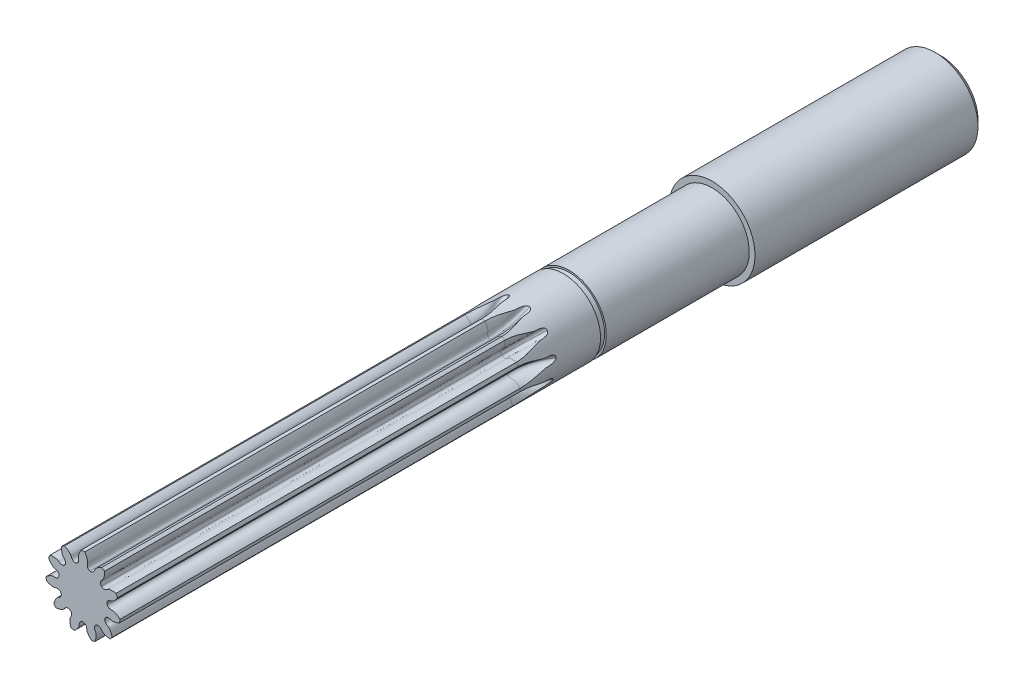
from build123d import *

# Parameters (mm, degrees)
EXTRUDE_1_DEPTH          = 70
PATTERN_CIRCULAR_1_COUNT = 11


with BuildPart() as part:
    # Эскиз1 → Бобышка-Вытянуть1 (new body)
    with BuildSketch(Plane.XY):
        with BuildLine():
            ThreePointArc((0.303, 6.493), (0, 6.500066), (-0.303, 6.493))
            add(Edge.make_bspline(
                [(-0.303, 6.493), (-0.346584218, 6.42959541), (-0.414908989, 6.322872217), (-0.503832534, 6.171085791), (-0.571642486, 6.040604913), (-0.631254096, 5.909462755), (-0.68518257, 5.779105167), (-0.72964324, 5.648408312), (-0.767399302, 5.518328721), (-0.797951002, 5.37284466), (-0.827792109, 5.196066136), (-0.768218484, 4.972302757), (-0.736721493, 4.755594452), (-0.753966504, 4.568401559), (-0.785235089, 4.447093131), (-0.829023332, 4.351746005), (-0.87759341, 4.275547448), (-0.932758863, 4.214584459), (-1.017734715, 4.14379099), (-1.09368593, 4.106410336), (-1.15, 4.092)],
                knots=[0, 0, 0, 0, 0.085617132, 0.140969585, 0.1957209, 0.24916994, 0.301247193, 0.352628837, 0.402767547, 0.451734397, 0.518547692, 0.59904648, 0.705842174, 0.760987907, 0.80705749, 0.844573024, 0.877292442, 0.9072362, 0.935685939, 1, 1, 1, 1], degree=3))
            ThreePointArc((-1.15, 4.092), (-1.197511317, 4.07834901), (-1.244860662, 4.064146396))
            add(Edge.make_bspline(
                [(-3.255481007, 5.626073356), (-3.184536521, 5.596297428), (-3.069359152, 5.543455325), (-2.912489968, 5.463840156), (-2.784901317, 5.390733484), (-2.663852036, 5.31263815), (-2.548007884, 5.232130303), (-2.439945133, 5.146218365), (-2.337856377, 5.057200918), (-2.23350003, 4.951329433), (-2.112822407, 4.818747197), (-2.041963313, 4.59829753), (-1.951298913, 4.398962343), (-1.835587368, 4.250809018), (-1.743698272, 4.165662948), (-1.655312711, 4.109125552), (-1.573256911, 4.071282214), (-1.493889699, 4.04982158), (-1.384129623, 4.036207738), (-1.300025889, 4.045823457), (-1.244860662, 4.064146396)],
                knots=[0, 0, 0, 0, 0.085617132, 0.140969585, 0.1957209, 0.24916994, 0.301247193, 0.352628837, 0.402767547, 0.451734397, 0.518547692, 0.59904648, 0.705842174, 0.760987907, 0.80705749, 0.844573024, 0.877292442, 0.9072362, 0.935685939, 1, 1, 1, 1], degree=3))
            ThreePointArc((-3.255481007, 5.626073356), (-3.514200996, 5.468203486), (-3.765280648, 5.298445021))
            add(Edge.make_bspline(
                [(-3.765280648, 5.298445021), (-3.767666916, 5.221542278), (-3.767446457, 5.094821856), (-3.760191766, 4.91905529), (-3.746693839, 4.772626962), (-3.725941513, 4.630074689), (-3.700832399, 4.491254973), (-3.66757504, 4.357268529), (-3.629011125, 4.227426146), (-3.576058228, 4.08851967), (-3.50558848, 3.923670791), (-3.334496341, 3.767636991), (-3.190838031, 3.602358923), (-3.104141339, 3.435558884), (-3.064861858, 3.316602666), (-3.050150324, 3.212717849), (-3.049814024, 3.122356577), (-3.063263076, 3.041246552), (-3.096475473, 2.935749881), (-3.140160193, 2.863240947), (-3.179743788, 2.820672516)],
                knots=[0, 0, 0, 0, 0.085617132, 0.140969585, 0.1957209, 0.24916994, 0.301247193, 0.352628837, 0.402767547, 0.451734397, 0.518547692, 0.59904648, 0.705842174, 0.760987907, 0.80705749, 0.844573024, 0.877292442, 0.9072362, 0.935685939, 1, 1, 1, 1], degree=3))
            ThreePointArc((-3.179743788, 2.820672516), (-3.212332568, 2.783502015), (-3.24448686, 2.745955028))
            add(Edge.make_bspline(
                [(-5.780369797, 2.972908174), (-5.704589415, 2.986214554), (-5.579127449, 3.004030536), (-5.404117483, 3.021863877), (-5.257258629, 3.029342263), (-5.113203968, 3.029088471), (-4.972223838, 3.023991037), (-4.834868167, 3.010140449), (-4.700859174, 2.990447556), (-4.555830583, 2.957802096), (-4.382630738, 2.91151007), (-4.203836187, 2.764365327), (-4.019795702, 2.645690773), (-3.842355221, 2.583614649), (-3.719019753, 2.561664212), (-3.614098664, 2.561886771), (-3.524609278, 2.574413643), (-3.446238836, 2.599268963), (-3.346542586, 2.647157048), (-3.280988673, 2.700716217), (-3.24448686, 2.745955028)],
                knots=[0, 0, 0, 0, 0.085617132, 0.140969585, 0.1957209, 0.24916994, 0.301247193, 0.352628837, 0.402767547, 0.451734397, 0.518547692, 0.59904648, 0.705842174, 0.760987907, 0.80705749, 0.844573024, 0.877292442, 0.9072362, 0.935685939, 1, 1, 1, 1], degree=3))
            ThreePointArc((-5.780369797, 2.972908174), (-5.912668005, 2.700225002), (-6.032111295, 2.421671185))
            add(Edge.make_bspline(
                [(-6.032111295, 2.421671185), (-5.992541989, 2.355686367), (-5.923846295, 2.249201553), (-5.82271668, 2.105259491), (-5.732196371, 1.989373673), (-5.637668826, 1.880670624), (-5.541494091, 1.777463059), (-5.441077679, 1.682726776), (-5.338437556, 1.594345639), (-5.218792234, 1.506118572), (-5.070385277, 1.405537693), (-4.84209517, 1.366773102), (-4.631886039, 1.305399889), (-4.468773231, 1.211950537), (-4.371416643, 1.13311429), (-4.30287614, 1.053674476), (-4.253740234, 0.977839554), (-4.221202906, 0.902334353), (-4.192107146, 0.795628928), (-4.189655782, 0.711012789), (-4.19994139, 0.653801439)],
                knots=[0, 0, 0, 0, 0.085617132, 0.140969585, 0.1957209, 0.24916994, 0.301247193, 0.352628837, 0.402767547, 0.451734397, 0.518547692, 0.59904648, 0.705842174, 0.760987907, 0.80705749, 0.844573024, 0.877292442, 0.9072362, 0.935685939, 1, 1, 1, 1], degree=3))
            ThreePointArc((-4.19994139, 0.653801439), (-4.207260927, 0.604912798), (-4.214011404, 0.55594234))
            add(Edge.make_bspline(
                [(-6.470032018, -0.624134348), (-6.413475476, -0.571970341), (-6.317562201, -0.489152723), (-6.179975881, -0.379532831), (-6.060473472, -0.293843722), (-5.939149769, -0.216175396), (-5.817793856, -0.144244018), (-5.694754719, -0.081635791), (-5.571372399, -0.025751776), (-5.431717116, 0.025193492), (-5.260984775, 0.079889067), (-5.031020774, 0.052766665), (-4.812035757, 0.052431075), (-4.62920244, 0.096140883), (-4.513578739, 0.144355189), (-4.425433827, 0.201267041), (-4.356923104, 0.260186931), (-4.304431493, 0.323466817), (-4.246451924, 0.417652699), (-4.220260736, 0.498150661), (-4.214011404, 0.55594234)],
                knots=[0, 0, 0, 0, 0.085617132, 0.140969585, 0.1957209, 0.24916994, 0.301247193, 0.352628837, 0.402767547, 0.451734397, 0.518547692, 0.59904648, 0.705842174, 0.760987907, 0.80705749, 0.844573024, 0.877292442, 0.9072362, 0.935685939, 1, 1, 1, 1], degree=3))
            ThreePointArc((-6.470032018, -0.624134348), (-6.4339047, -0.925055842), (-6.383789226, -1.223966142))
            add(Edge.make_bspline(
                [(-6.383789226, -1.223966142), (-6.314827322, -1.258083321), (-6.199466789, -1.310524351), (-6.03657019, -1.376941321), (-5.897767057, -1.425491701), (-5.75947612, -1.465833076), (-5.622770562, -1.500660817), (-5.4870766, -1.526068839), (-5.352947784, -1.544928343), (-5.204596581, -1.55446453), (-5.025370575, -1.558843691), (-4.812362995, -1.468031591), (-4.602342957, -1.406014386), (-4.414601197, -1.396443541), (-4.29007753, -1.410129868), (-4.189469184, -1.439903098), (-4.107133975, -1.477134618), (-4.03894064, -1.523062628), (-3.956774421, -1.597098588), (-3.908965263, -1.666956907), (-3.886687276, -1.720646976)],
                knots=[0, 0, 0, 0, 0.085617132, 0.140969585, 0.1957209, 0.24916994, 0.301247193, 0.352628837, 0.402767547, 0.451734397, 0.518547692, 0.59904648, 0.705842174, 0.760987907, 0.80705749, 0.844573024, 0.877292442, 0.9072362, 0.935685939, 1, 1, 1, 1], degree=3))
            ThreePointArc((-3.886687276, -1.720646976), (-3.866413668, -1.765731958), (-3.845617102, -1.810578113))
            add(Edge.make_bspline(
                [(-5.105504789, -4.023018624), (-5.08612839, -3.948558694), (-5.050215592, -3.827033449), (-4.993735603, -3.660430547), (-4.939530809, -3.523736401), (-4.879457483, -3.392805102), (-4.816255431, -3.266682615), (-4.746596885, -3.147493244), (-4.673014252, -3.0337751), (-4.583071843, -2.915413868), (-4.469013319, -2.777096149), (-4.260891813, -2.67558504), (-4.07648846, -2.557475118), (-3.946310592, -2.421856933), (-3.875108367, -2.318785587), (-3.831725018, -2.223253553), (-3.805944628, -2.136647294), (-3.795997565, -2.055033759), (-3.798142779, -1.944453431), (-3.819629834, -1.862574211), (-3.845617102, -1.810578113)],
                knots=[0, 0, 0, 0, 0.085617132, 0.140969585, 0.1957209, 0.24916994, 0.301247193, 0.352628837, 0.402767547, 0.451734397, 0.518547692, 0.59904648, 0.705842174, 0.760987907, 0.80705749, 0.844573024, 0.877292442, 0.9072362, 0.935685939, 1, 1, 1, 1], degree=3))
            ThreePointArc((-5.105504789, -4.023018624), (-4.912422113, -4.256637991), (-4.708659184, -4.481002867))
            add(Edge.make_bspline(
                [(-4.708659184, -4.481002867), (-4.632199599, -4.472420444), (-4.506800382, -4.454168033), (-4.333855317, -4.421972993), (-4.190838374, -4.387773532), (-4.052690441, -4.346945132), (-3.918857109, -4.302335487), (-3.790967469, -4.250348381), (-3.667934912, -4.193698492), (-3.537978286, -4.121516127), (-3.384836222, -4.028303218), (-3.254739572, -3.836746626), (-3.111588505, -3.671029028), (-2.958824475, -3.561476663), (-2.846669114, -3.505667756), (-2.745935363, -3.476321613), (-2.656541699, -3.463128986), (-2.574343258, -3.464897986), (-2.465193774, -3.482758587), (-2.387205893, -3.515679562), (-2.339437414, -3.548802134)],
                knots=[0, 0, 0, 0, 0.085617132, 0.140969585, 0.1957209, 0.24916994, 0.301247193, 0.352628837, 0.402767547, 0.451734397, 0.518547692, 0.59904648, 0.705842174, 0.760987907, 0.80705749, 0.844573024, 0.877292442, 0.9072362, 0.935685939, 1, 1, 1, 1], degree=3))
            ThreePointArc((-2.339437414, -3.548802134), (-2.298007388, -3.575769294), (-2.256266542, -3.602252808))
            add(Edge.make_bspline(
                [(-2.120015863, -6.144622913), (-2.143971476, -6.071507561), (-2.179461216, -5.949858095), (-2.222019554, -5.779167428), (-2.250322015, -5.634867671), (-2.270571922, -5.492243161), (-2.285589937, -5.351972564), (-2.291428078, -5.214043831), (-2.291007098, -5.078596266), (-2.279333643, -4.930397924), (-2.258161711, -4.752372961), (-2.137959807, -4.554457401), (-2.04668488, -4.355401032), (-2.010493015, -4.170932286), (-2.006318469, -4.045728322), (-2.02147059, -3.941906852), (-2.046605625, -3.855111099), (-2.082361231, -3.781075636), (-2.143950139, -3.689209335), (-2.206293448, -3.631944931), (-2.256266542, -3.602252808)],
                knots=[0, 0, 0, 0, 0.085617132, 0.140969585, 0.1957209, 0.24916994, 0.301247193, 0.352628837, 0.402767547, 0.451734397, 0.518547692, 0.59904648, 0.705842174, 0.760987907, 0.80705749, 0.844573024, 0.877292442, 0.9072362, 0.935685939, 1, 1, 1, 1], degree=3))
            ThreePointArc((-2.120015863, -6.144622913), (-1.831280214, -6.236767655), (-1.538563121, -6.315352842))
            add(Edge.make_bspline(
                [(-1.538563121, -6.315352842), (-1.478881232, -6.266795677), (-1.383256697, -6.183644836), (-1.255172002, -6.063059484), (-1.153348118, -5.956968269), (-1.059204181, -5.847932822), (-0.970734213, -5.738049039), (-0.891252954, -5.625172343), (-0.818378622, -5.510999001), (-0.748076884, -5.380015475), (-0.669640285, -5.218804936), (-0.663759331, -4.987321716), (-0.632926688, -4.770517892), (-0.563641889, -4.595766108), (-0.499463367, -4.488180901), (-0.430586467, -4.409032577), (-0.362516204, -4.34960437), (-0.292410081, -4.306652715), (-0.190931522, -4.262667342), (-0.107525519, -4.248198797), (-0.049432703, -4.250237688)],
                knots=[0, 0, 0, 0, 0.085617132, 0.140969585, 0.1957209, 0.24916994, 0.301247193, 0.352628837, 0.402767547, 0.451734397, 0.518547692, 0.59904648, 0.705842174, 0.760987907, 0.80705749, 0.844573024, 0.877292442, 0.9072362, 0.935685939, 1, 1, 1, 1], degree=3))
            ThreePointArc((-0.049432703, -4.250237688), (0, -4.250525144), (0.049432703, -4.250237688))
            add(Edge.make_bspline(
                [(1.538563121, -6.315352842), (1.478881232, -6.266795677), (1.383256697, -6.183644836), (1.255172002, -6.063059484), (1.153348118, -5.956968269), (1.059204181, -5.847932822), (0.970734213, -5.738049039), (0.891252954, -5.625172343), (0.818378622, -5.510999001), (0.748076884, -5.380015475), (0.669640285, -5.218804936), (0.663759331, -4.987321716), (0.632926688, -4.770517892), (0.563641889, -4.595766108), (0.499463367, -4.488180901), (0.430586467, -4.409032577), (0.362516204, -4.34960437), (0.292410081, -4.306652715), (0.190931522, -4.262667342), (0.107525519, -4.248198797), (0.049432703, -4.250237688)],
                knots=[0, 0, 0, 0, 0.085617132, 0.140969585, 0.1957209, 0.24916994, 0.301247193, 0.352628837, 0.402767547, 0.451734397, 0.518547692, 0.59904648, 0.705842174, 0.760987907, 0.80705749, 0.844573024, 0.877292442, 0.9072362, 0.935685939, 1, 1, 1, 1], degree=3))
            ThreePointArc((1.538563121, -6.315352842), (1.831280214, -6.236767655), (2.120015863, -6.144622913))
            add(Edge.make_bspline(
                [(2.120015863, -6.144622913), (2.143971476, -6.071507561), (2.179461216, -5.949858095), (2.222019554, -5.779167428), (2.250322015, -5.634867671), (2.270571922, -5.492243161), (2.285589937, -5.351972564), (2.291428078, -5.214043831), (2.291007098, -5.078596266), (2.279333643, -4.930397924), (2.258161711, -4.752372961), (2.137959807, -4.554457401), (2.04668488, -4.355401032), (2.010493015, -4.170932286), (2.006318469, -4.045728322), (2.02147059, -3.941906852), (2.046605625, -3.855111099), (2.082361231, -3.781075636), (2.143950139, -3.689209335), (2.206293448, -3.631944931), (2.256266542, -3.602252808)],
                knots=[0, 0, 0, 0, 0.085617132, 0.140969585, 0.1957209, 0.24916994, 0.301247193, 0.352628837, 0.402767547, 0.451734397, 0.518547692, 0.59904648, 0.705842174, 0.760987907, 0.80705749, 0.844573024, 0.877292442, 0.9072362, 0.935685939, 1, 1, 1, 1], degree=3))
            ThreePointArc((2.256266542, -3.602252808), (2.298007388, -3.575769294), (2.339437414, -3.548802134))
            add(Edge.make_bspline(
                [(4.708659184, -4.481002867), (4.632199599, -4.472420444), (4.506800382, -4.454168033), (4.333855317, -4.421972993), (4.190838374, -4.387773532), (4.052690441, -4.346945132), (3.918857109, -4.302335487), (3.790967469, -4.250348381), (3.667934912, -4.193698492), (3.537978286, -4.121516127), (3.384836222, -4.028303218), (3.254739572, -3.836746626), (3.111588505, -3.671029028), (2.958824475, -3.561476663), (2.846669114, -3.505667756), (2.745935363, -3.476321613), (2.656541699, -3.463128986), (2.574343258, -3.464897986), (2.465193774, -3.482758587), (2.387205893, -3.515679562), (2.339437414, -3.548802134)],
                knots=[0, 0, 0, 0, 0.085617132, 0.140969585, 0.1957209, 0.24916994, 0.301247193, 0.352628837, 0.402767547, 0.451734397, 0.518547692, 0.59904648, 0.705842174, 0.760987907, 0.80705749, 0.844573024, 0.877292442, 0.9072362, 0.935685939, 1, 1, 1, 1], degree=3))
            ThreePointArc((4.708659184, -4.481002867), (4.912422113, -4.256637991), (5.105504789, -4.023018624))
            add(Edge.make_bspline(
                [(5.105504789, -4.023018624), (5.08612839, -3.948558694), (5.050215592, -3.827033449), (4.993735603, -3.660430547), (4.939530809, -3.523736401), (4.879457483, -3.392805102), (4.816255431, -3.266682615), (4.746596885, -3.147493244), (4.673014252, -3.0337751), (4.583071843, -2.915413868), (4.469013319, -2.777096149), (4.260891813, -2.67558504), (4.07648846, -2.557475118), (3.946310592, -2.421856933), (3.875108367, -2.318785587), (3.831725018, -2.223253553), (3.805944628, -2.136647294), (3.795997565, -2.055033759), (3.798142779, -1.944453431), (3.819629834, -1.862574211), (3.845617102, -1.810578113)],
                knots=[0, 0, 0, 0, 0.085617132, 0.140969585, 0.1957209, 0.24916994, 0.301247193, 0.352628837, 0.402767547, 0.451734397, 0.518547692, 0.59904648, 0.705842174, 0.760987907, 0.80705749, 0.844573024, 0.877292442, 0.9072362, 0.935685939, 1, 1, 1, 1], degree=3))
            ThreePointArc((3.845617102, -1.810578113), (3.866413668, -1.765731958), (3.886687276, -1.720646976))
            add(Edge.make_bspline(
                [(6.383789226, -1.223966142), (6.314827322, -1.258083321), (6.199466789, -1.310524351), (6.03657019, -1.376941321), (5.897767057, -1.425491701), (5.75947612, -1.465833076), (5.622770562, -1.500660817), (5.4870766, -1.526068839), (5.352947784, -1.544928343), (5.204596581, -1.55446453), (5.025370575, -1.558843691), (4.812362995, -1.468031591), (4.602342957, -1.406014386), (4.414601197, -1.396443541), (4.29007753, -1.410129868), (4.189469184, -1.439903098), (4.107133975, -1.477134618), (4.03894064, -1.523062628), (3.956774421, -1.597098588), (3.908965263, -1.666956907), (3.886687276, -1.720646976)],
                knots=[0, 0, 0, 0, 0.085617132, 0.140969585, 0.1957209, 0.24916994, 0.301247193, 0.352628837, 0.402767547, 0.451734397, 0.518547692, 0.59904648, 0.705842174, 0.760987907, 0.80705749, 0.844573024, 0.877292442, 0.9072362, 0.935685939, 1, 1, 1, 1], degree=3))
            ThreePointArc((6.383789226, -1.223966142), (6.4339047, -0.925055842), (6.470032018, -0.624134348))
            add(Edge.make_bspline(
                [(6.470032018, -0.624134348), (6.413475476, -0.571970341), (6.317562201, -0.489152723), (6.179975881, -0.379532831), (6.060473472, -0.293843722), (5.939149769, -0.216175396), (5.817793856, -0.144244018), (5.694754719, -0.081635791), (5.571372399, -0.025751776), (5.431717116, 0.025193492), (5.260984775, 0.079889067), (5.031020774, 0.052766665), (4.812035757, 0.052431075), (4.62920244, 0.096140883), (4.513578739, 0.144355189), (4.425433827, 0.201267041), (4.356923104, 0.260186931), (4.304431493, 0.323466817), (4.246451924, 0.417652699), (4.220260736, 0.498150661), (4.214011404, 0.55594234)],
                knots=[0, 0, 0, 0, 0.085617132, 0.140969585, 0.1957209, 0.24916994, 0.301247193, 0.352628837, 0.402767547, 0.451734397, 0.518547692, 0.59904648, 0.705842174, 0.760987907, 0.80705749, 0.844573024, 0.877292442, 0.9072362, 0.935685939, 1, 1, 1, 1], degree=3))
            ThreePointArc((4.214011404, 0.55594234), (4.207260927, 0.604912798), (4.19994139, 0.653801439))
            add(Edge.make_bspline(
                [(6.032111295, 2.421671185), (5.992541989, 2.355686367), (5.923846295, 2.249201553), (5.82271668, 2.105259491), (5.732196371, 1.989373673), (5.637668826, 1.880670624), (5.541494091, 1.777463059), (5.441077679, 1.682726776), (5.338437556, 1.594345639), (5.218792234, 1.506118572), (5.070385277, 1.405537693), (4.84209517, 1.366773102), (4.631886039, 1.305399889), (4.468773231, 1.211950537), (4.371416643, 1.13311429), (4.30287614, 1.053674476), (4.253740234, 0.977839554), (4.221202906, 0.902334353), (4.192107146, 0.795628928), (4.189655782, 0.711012789), (4.19994139, 0.653801439)],
                knots=[0, 0, 0, 0, 0.085617132, 0.140969585, 0.1957209, 0.24916994, 0.301247193, 0.352628837, 0.402767547, 0.451734397, 0.518547692, 0.59904648, 0.705842174, 0.760987907, 0.80705749, 0.844573024, 0.877292442, 0.9072362, 0.935685939, 1, 1, 1, 1], degree=3))
            ThreePointArc((6.032111295, 2.421671185), (5.912668005, 2.700225002), (5.780369797, 2.972908174))
            add(Edge.make_bspline(
                [(5.780369797, 2.972908174), (5.704589415, 2.986214554), (5.579127449, 3.004030536), (5.404117483, 3.021863877), (5.257258629, 3.029342263), (5.113203968, 3.029088471), (4.972223838, 3.023991037), (4.834868167, 3.010140449), (4.700859174, 2.990447556), (4.555830583, 2.957802096), (4.382630738, 2.91151007), (4.203836187, 2.764365327), (4.019795702, 2.645690773), (3.842355221, 2.583614649), (3.719019753, 2.561664212), (3.614098664, 2.561886771), (3.524609278, 2.574413643), (3.446238836, 2.599268963), (3.346542586, 2.647157048), (3.280988673, 2.700716217), (3.24448686, 2.745955028)],
                knots=[0, 0, 0, 0, 0.085617132, 0.140969585, 0.1957209, 0.24916994, 0.301247193, 0.352628837, 0.402767547, 0.451734397, 0.518547692, 0.59904648, 0.705842174, 0.760987907, 0.80705749, 0.844573024, 0.877292442, 0.9072362, 0.935685939, 1, 1, 1, 1], degree=3))
            ThreePointArc((3.24448686, 2.745955028), (3.212332568, 2.783502015), (3.179743788, 2.820672516))
            add(Edge.make_bspline(
                [(3.765280648, 5.298445021), (3.767666916, 5.221542278), (3.767446457, 5.094821856), (3.760191766, 4.91905529), (3.746693839, 4.772626962), (3.725941513, 4.630074689), (3.700832399, 4.491254973), (3.66757504, 4.357268529), (3.629011125, 4.227426146), (3.576058228, 4.08851967), (3.50558848, 3.923670791), (3.334496341, 3.767636991), (3.190838031, 3.602358923), (3.104141339, 3.435558884), (3.064861858, 3.316602666), (3.050150324, 3.212717849), (3.049814024, 3.122356577), (3.063263076, 3.041246552), (3.096475473, 2.935749881), (3.140160193, 2.863240947), (3.179743788, 2.820672516)],
                knots=[0, 0, 0, 0, 0.085617132, 0.140969585, 0.1957209, 0.24916994, 0.301247193, 0.352628837, 0.402767547, 0.451734397, 0.518547692, 0.59904648, 0.705842174, 0.760987907, 0.80705749, 0.844573024, 0.877292442, 0.9072362, 0.935685939, 1, 1, 1, 1], degree=3))
            ThreePointArc((3.765280648, 5.298445021), (3.514200996, 5.468203486), (3.255481007, 5.626073356))
            add(Edge.make_bspline(
                [(3.255481007, 5.626073356), (3.184536521, 5.596297428), (3.069359152, 5.543455325), (2.912489968, 5.463840156), (2.784901317, 5.390733484), (2.663852036, 5.31263815), (2.548007884, 5.232130303), (2.439945133, 5.146218365), (2.337856377, 5.057200918), (2.23350003, 4.951329433), (2.112822407, 4.818747197), (2.041963313, 4.59829753), (1.951298913, 4.398962343), (1.835587368, 4.250809018), (1.743698272, 4.165662948), (1.655312711, 4.109125552), (1.573256911, 4.071282214), (1.493889699, 4.04982158), (1.384129623, 4.036207738), (1.300025889, 4.045823457), (1.244860662, 4.064146396)],
                knots=[0, 0, 0, 0, 0.085617132, 0.140969585, 0.1957209, 0.24916994, 0.301247193, 0.352628837, 0.402767547, 0.451734397, 0.518547692, 0.59904648, 0.705842174, 0.760987907, 0.80705749, 0.844573024, 0.877292442, 0.9072362, 0.935685939, 1, 1, 1, 1], degree=3))
            ThreePointArc((1.244860662, 4.064146396), (1.197511317, 4.07834901), (1.15, 4.092))
            add(Edge.make_bspline(
                [(0.303, 6.493), (0.346584218, 6.42959541), (0.414908989, 6.322872217), (0.503832534, 6.171085791), (0.571642486, 6.040604913), (0.631254096, 5.909462755), (0.68518257, 5.779105167), (0.72964324, 5.648408312), (0.767399302, 5.518328721), (0.797951002, 5.37284466), (0.827792109, 5.196066136), (0.768218484, 4.972302757), (0.736721493, 4.755594452), (0.753966504, 4.568401559), (0.785235089, 4.447093131), (0.829023332, 4.351746005), (0.87759341, 4.275547448), (0.932758863, 4.214584459), (1.017734715, 4.14379099), (1.09368593, 4.106410336), (1.15, 4.092)],
                knots=[0, 0, 0, 0, 0.085617132, 0.140969585, 0.1957209, 0.24916994, 0.301247193, 0.352628837, 0.402767547, 0.451734397, 0.518547692, 0.59904648, 0.705842174, 0.760987907, 0.80705749, 0.844573024, 0.877292442, 0.9072362, 0.935685939, 1, 1, 1, 1], degree=3))
        make_face()
    extrude(amount=EXTRUDE_1_DEPTH)

    # Эскиз3 → Повернуть1 (revolve)
    with BuildSketch(Plane(origin=(0, 0, 0), x_dir=(0, 0, -1), z_dir=(1, 0, 0))):
        Polygon((40, 6.5), (40, 7.5), (79, 7.5), (80, 6.5), (80, 0), (0, 0), (0, 6.5), (14, 6.5), (14, 6.2), (15, 6.2), (15, 6.5), align=None)
    revolve(axis=Axis((0, 0, -80), (0, 0, 1)))

    # Эскиз5 → Вырез-Повернуть1 (revolve, cut)
    with BuildSketch(Plane.XY):
        with BuildLine():
            ThreePointArc((4.668186259, 5.870096852), (2.112994176, 7.196197302), (-0.753514222, 7.46205175))
            ThreePointArc((-0.753514222, 7.46205175), (-0.260168872, 6.939463128), (0.303, 6.493))
            add(Edge.make_bspline(
                [(1.15, 4.092), (1.09368593, 4.106410336), (1.017734715, 4.14379099), (0.932758863, 4.214584459), (0.87759341, 4.275547448), (0.829023332, 4.351746005), (0.785235089, 4.447093131), (0.753966504, 4.568401559), (0.736721493, 4.755594452), (0.768218484, 4.972302757), (0.827792109, 5.196066136), (0.797951002, 5.37284466), (0.767399302, 5.518328721), (0.72964324, 5.648408312), (0.68518257, 5.779105167), (0.631254096, 5.909462755), (0.571642486, 6.040604913), (0.503832534, 6.171085791), (0.414908989, 6.322872217), (0.346584218, 6.42959541), (0.303, 6.493)],
                knots=[0, 0, 0, 0, 0.064314061, 0.0927638, 0.122707558, 0.155426976, 0.19294251, 0.239012093, 0.294157826, 0.40095352, 0.481452308, 0.548265603, 0.597232453, 0.647371163, 0.698752807, 0.75083006, 0.8042791, 0.859030415, 0.914382868, 1, 1, 1, 1], degree=3))
            ThreePointArc((1.15, 4.092), (1.197511317, 4.07834901), (1.244860662, 4.064146396))
            add(Edge.make_bspline(
                [(1.244860662, 4.064146396), (1.300025889, 4.045823457), (1.384129623, 4.036207738), (1.493889699, 4.04982158), (1.573256911, 4.071282214), (1.655312711, 4.109125552), (1.743698272, 4.165662948), (1.835587368, 4.250809018), (1.951298913, 4.398962343), (2.041963313, 4.59829753), (2.112822407, 4.818747197), (2.23350003, 4.951329433), (2.337856377, 5.057200918), (2.439945133, 5.146218365), (2.548007884, 5.232130303), (2.663852036, 5.31263815), (2.784901317, 5.390733484), (2.912489968, 5.463840156), (3.069359152, 5.543455325), (3.184536521, 5.596297428), (3.255481007, 5.626073356)],
                knots=[0, 0, 0, 0, 0.064314061, 0.0927638, 0.122707558, 0.155426976, 0.19294251, 0.239012093, 0.294157826, 0.40095352, 0.481452308, 0.548265603, 0.597232453, 0.647371163, 0.698752807, 0.75083006, 0.8042791, 0.859030415, 0.914382868, 1, 1, 1, 1], degree=3))
            ThreePointArc((3.255481007, 5.626073356), (3.970625001, 5.697189961), (4.668186259, 5.870096852))
        make_face()
    cut_revolve_1 = revolve(axis=Axis((2.486427316, 13.929070546, 0), (0.9594929736144975, -0.2817325568414294, 0)), mode=Mode.SUBTRACT)

    # Круговой массив1: Вырез-Повернуть1 ×11 about axis
    pattern_circular_1_axis = Axis((0, 0, -80), (0, 0, -1))
    for i in range(1, PATTERN_CIRCULAR_1_COUNT):
        add(cut_revolve_1.rotate(pattern_circular_1_axis, i * 360 / PATTERN_CIRCULAR_1_COUNT), mode=Mode.SUBTRACT)


solid = part.part
